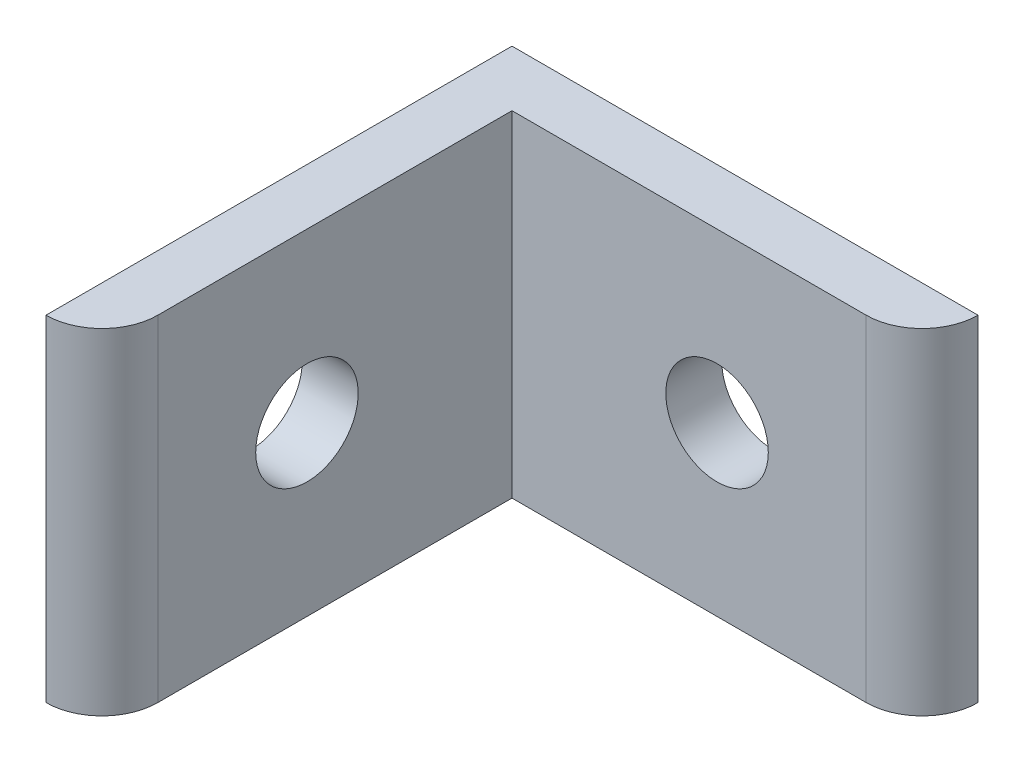
from build123d import *

# Parameters (mm, degrees)
BOSS_EXTRUDE1_DEPTH = 18
SKETCH3_R           = 2.75
CUT_EXTRUDE2_DEPTH  = 38.854986461
FILLET1_R           = 3


with BuildPart() as part:
    # Sketch2 → Boss-Extrude1 (new body)
    with BuildSketch(Plane(origin=(0, 0, 0), x_dir=(-1, 0, 0), z_dir=(0, 1, 0))):
        Polygon((0, 0), (0, 25), (-3, 25), (-3, 3), (-25, 3), (-25, 0), align=None)
    extrude(amount=BOSS_EXTRUDE1_DEPTH)

    # Sketch3 → Cut-Extrude2 (cut, through all)
    with BuildSketch(Plane.XY.offset(3)):
        with Locations((14, 9)):
            Circle(SKETCH3_R)
    cut_extrude2 = extrude(amount=-CUT_EXTRUDE2_DEPTH, mode=Mode.SUBTRACT)

    # Mirror1: Cut-Extrude2 across plane
    add(cut_extrude2.mirror(Plane(origin=(0, 0, 0), x_dir=(0.7071067811865465, 0, 0.7071067811865486), z_dir=(-0.7071067811865488, 0, 0.7071067811865464))), mode=Mode.SUBTRACT)

    # Fillet1
    fillet1_edges = [part.edges().sort_by_distance(p)[0] for p in [
        (3, 9, 25),
        (25, 9, 3),
    ]]
    fillet(fillet1_edges, radius=FILLET1_R - 0.0001)  # a hair under: the kernel refuses the full size


solid = part.part
